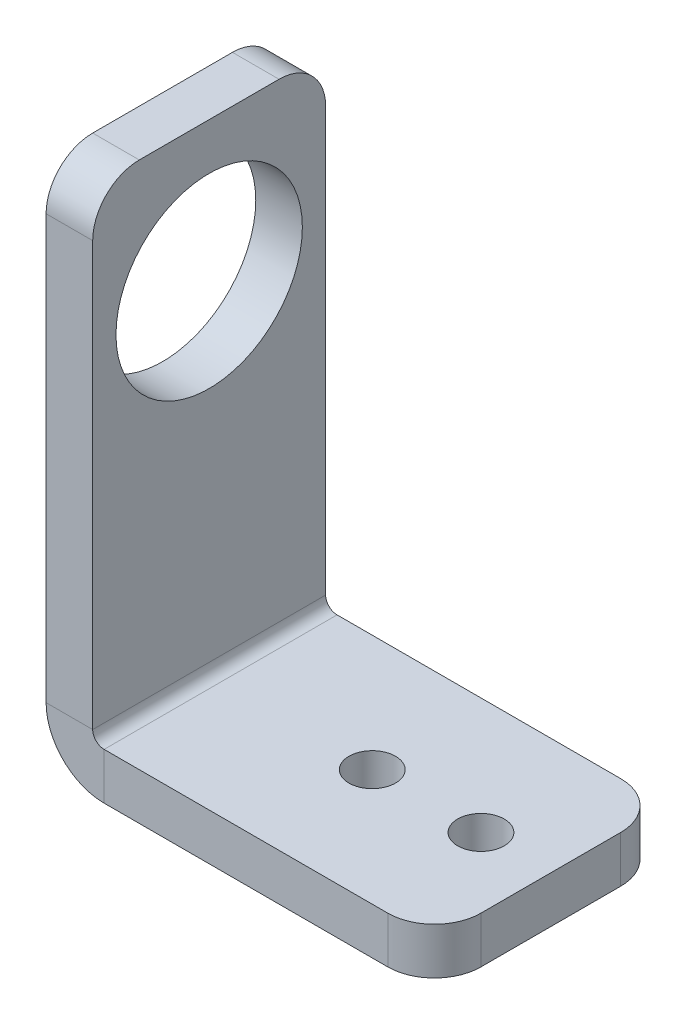
from build123d import *

# Parameters (mm, degrees)
BASE_FLANGE1_DEPTH = 7.5
SKETCH6_R          = 6
CUT_EXTRUDE1_DEPTH = 43.86315434
SKETCH7_R          = 1.5
CUT_EXTRUDE2_DEPTH = 41.524683836
FILLET1_R          = 3


# Sheet-metal steps are written as plain solids
with BuildPart() as part:
    # Sketch1 → Base-Flange1 (new, symmetric)
    with BuildSketch(Plane.XY):
        with BuildLine():
            Line((0, 0), (-21.2634, 0))
            ThreePointArc((-21.2634, 0), (-23.905575199, 1.094424801), (-25, 3.7366))
            Line((-25, 3.7366), (-25, 34))
            Line((-25, 34), (-22, 34))
            Line((-22, 34), (-22, 3.7366))
            ThreePointArc((-22, 3.7366), (-21.784254855, 3.215745145), (-21.2634, 3))
            Line((-21.2634, 3), (0, 3))
            Line((0, 3), (0, 0))
        make_face()
    extrude(amount=BASE_FLANGE1_DEPTH, both=True)

    # Sketch6 → Cut-Extrude1 (cut, through all)
    with BuildSketch(Plane.ZY.offset(25)):
        with Locations((0, 25)):
            Circle(SKETCH6_R)
    extrude(amount=-CUT_EXTRUDE1_DEPTH, mode=Mode.SUBTRACT)

    # Sketch7 → Cut-Extrude2 (cut, through all)
    with BuildSketch(Plane(origin=(0, 3, 0), x_dir=(1, 0, 0), z_dir=(0, 1, 0))):
        with Locations(Location((-4.5, 0, 0), (0, 0, 180))):
            Circle(SKETCH7_R)
        with Locations(Location((-11.5, 0, 0), (0, 0, 180))):
            Circle(SKETCH7_R)
    extrude(amount=-CUT_EXTRUDE2_DEPTH, mode=Mode.SUBTRACT)

    # Fillet1
    fillet1_edges = [part.edges().sort_by_distance(p)[0] for p in [
        (0, 1.5, 7.5),
        (0, 1.5, -7.5),
        (-23.5, 34, 7.5),
        (-23.5, 34, -7.5),
    ]]
    fillet(fillet1_edges, radius=FILLET1_R)


solid = part.part
